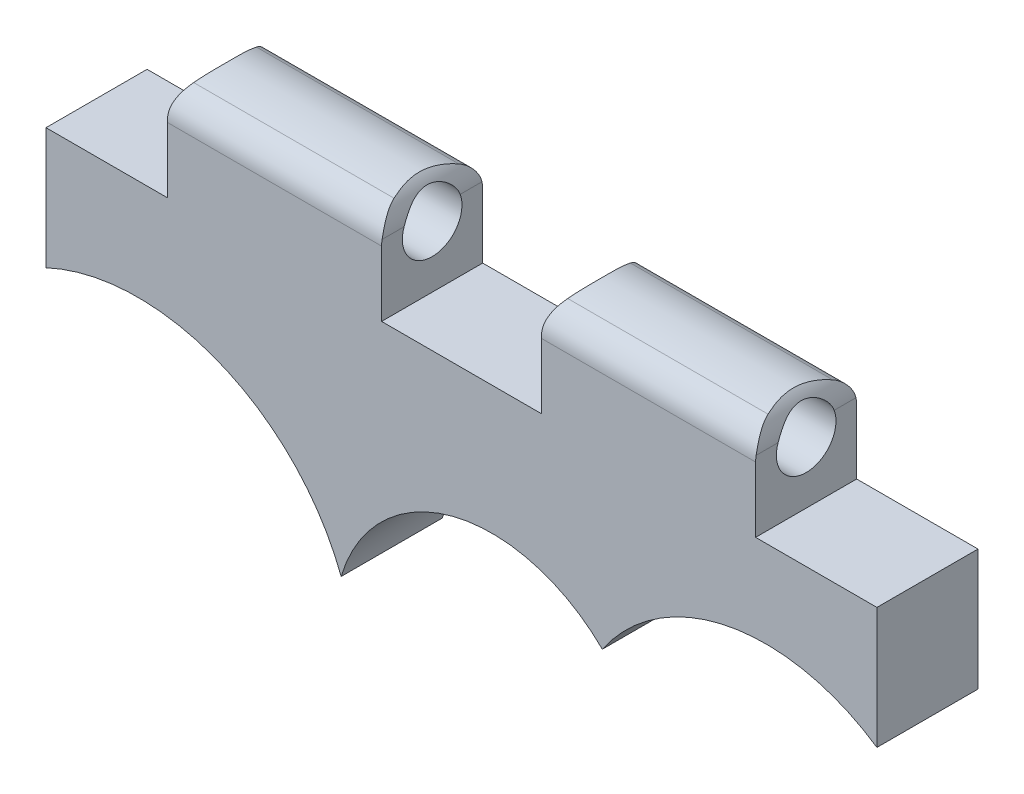
from build123d import *

# Parameters (mm, degrees)
SALIENTE_EXTRUIR1_DEPTH    = 5
CROQUIS5_R                 = 1.475
CORTAR_EXTRUIR3_DEPTH      = 10.6
CROQUIS10_R                = 1.475
CORTAR_EXTRUIR5_DEPTH      = 28.922395492
CORTAR_EXTRUIR6_DEPTH      = 38.568872355
CORTAR_EXTRUIR6_DEPTH_BACK = 38.568872355
REDONDEO5_R                = 1.5


with BuildPart() as part:
    # Croquis1 → Saliente-Extruir1 (new body)
    with BuildSketch(Plane.XY):
        with BuildLine():
            Line((-11.235063244, -0.5), (-5.235063244, -0.5))
            Line((-5.235063244, -0.5), (-5.235063244, 3))
            ThreePointArc((-5.235063244, 3), (-4.649276807, 4.414213562), (-3.235063244, 5))
            Line((-3.235063244, 5), (3.364936756, 5))
            ThreePointArc((3.364936756, 5), (4.779150318, 4.414213562), (5.364936756, 3))
            Line((5.364936756, 3), (5.364936756, -0.5))
            Line((5.364936756, -0.5), (13.264936756, -0.5))
            Line((13.264936756, -0.5), (13.264936756, 3))
            ThreePointArc((13.264936756, 3), (13.850723193, 4.414213562), (15.264936756, 5))
            Line((15.264936756, 5), (21.864936756, 5))
            ThreePointArc((21.864936756, 5), (23.279150318, 4.414213562), (23.864936756, 3))
            Line((23.864936756, 3), (23.864936756, -0.5))
            Line((23.864936756, -0.5), (29.864936756, -0.5))
            Line((29.864936756, -0.5), (29.864936756, -6.5))
            ThreePointArc((29.864936756, -6.5), (22.539313598, -4.979099508), (16.283876735, -9.083658268))
            ThreePointArc((16.283876735, -9.083658268), (8.876557279, -7.091468541), (3.364936756, -12.426188836))
            ThreePointArc((3.364936756, -12.426188836), (-2.643411058, -6.280927524), (-11.235063244, -6.5))
            Line((-11.235063244, -6.5), (-11.235063244, -0.5))
        make_face()
    extrude(amount=SALIENTE_EXTRUIR1_DEPTH)

    # Croquis5 → Cortar-Extruir3 (cut)
    with BuildSketch(Plane(origin=(23.864936756, 0, 0), x_dir=(0, 0, -1), z_dir=(1, 0, 0))):
        with Locations(Location((-2.5, 2.5, 0), (0, 0, 160.185071851))):
            Circle(CROQUIS5_R)
    extrude(amount=-CORTAR_EXTRUIR3_DEPTH, mode=Mode.SUBTRACT)

    # Croquis10 → Cortar-Extruir5 (cut, through all)
    with BuildSketch(Plane(origin=(5.364936756, 0, 0), x_dir=(0, 0, -1), z_dir=(1, 0, 0))):
        with Locations(Location((-2.5, 2.5, 0), (0, 0, 160.185071851))):
            Circle(CROQUIS10_R)
    extrude(amount=-CORTAR_EXTRUIR5_DEPTH, mode=Mode.SUBTRACT)

    # Croquis12 → Cortar-Extruir6 (cut, two sides: drawn at the far end of the back side and taken through both)
    with BuildSketch(Plane(origin=(23.864936756, 0, 0), x_dir=(0, 0, -1), z_dir=(1, 0, 0)).offset(-CORTAR_EXTRUIR6_DEPTH_BACK)):
        with BuildLine():
            Line((-35.945468922, -27.281986612), (-5.466117705, 3.197364605))
            ThreePointArc((-5.466117705, 3.197364605), (-2.561384811, 4.400544365), (0.343348083, 3.197364605))
            Line((0.343348083, 3.197364605), (30.8226993, -27.281986612))
            Line((30.8226993, -27.281986612), (30.8226993, 58.926637114))
            Line((30.8226993, 58.926637114), (-35.945468922, 58.926637114))
            Line((-35.945468922, 58.926637114), (-35.945468922, -27.281986612))
        make_face()
    extrude(amount=CORTAR_EXTRUIR6_DEPTH + CORTAR_EXTRUIR6_DEPTH_BACK, mode=Mode.SUBTRACT)

    # Redondeo5
    # the kernel refuses this fillet: 1.5 mm, written as the material it takes off along each edge
    with BuildSketch(Plane(origin=(7.90277719, 3.504212976, 0), x_dir=(0, -1, 0), z_dir=(-1, 0, 0)), Plane(origin=(26.40277719, 3.504212976, 0), x_dir=(0, -1, 0), z_dir=(-1, 0, 0))) as redondeo5_piece_1:
        with BuildLine():
            CenterArc((0.829424534, 1.5), REDONDEO5_R, 204.015661093, 65.984338907)
            ThreePointArc((-0.540726837, 0.889520499), (-0.298653835, 0.427562908), (0, 0))
            Line((0, 0), (0.829424534, 0))
        make_face()
    extrude(amount=15.675680868, mode=Mode.SUBTRACT)
    with BuildSketch(Plane(origin=(8.011290884, 3.59839975, 5), x_dir=(0, -1, 0), z_dir=(-1, 0, 0)), Plane(origin=(26.511290884, 3.59839975, 5), x_dir=(0, -1, 0), z_dir=(-1, 0, 0))) as redondeo5_piece_2:
        with BuildLine():
            CenterArc((0.872619886, -1.5), REDONDEO5_R, 90, 68.905299391)
            ThreePointArc((-0.526860355, -0.960134226), (-0.295570649, -0.462430475), (0, 0))
            Line((0, 0), (0.872619886, 0))
        make_face()
    extrude(amount=15.892708257, mode=Mode.SUBTRACT)


solid = part.part
